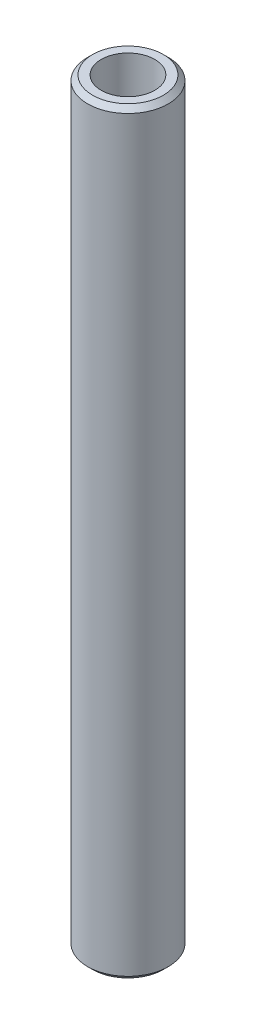
from build123d import *

# Parameters (mm, degrees)
SKETCH1_R           = 12.5
BOSS_EXTRUDE1_DEPTH = 234.681950535
SKETCH2_R           = 8.308721888
CUT_EXTRUDE1_DEPTH  = 236.346803478
CHAMFER1_SIZE       = 1.542651044


with BuildPart() as part:
    # Sketch1 → Boss-Extrude1 (new body)
    with BuildSketch(Plane(origin=(0, 0, 0), x_dir=(1, 0, 0), z_dir=(0, 1, 0))):
        Circle(SKETCH1_R)
    extrude(amount=BOSS_EXTRUDE1_DEPTH)

    # Sketch2 → Cut-Extrude1 (cut, through all)
    with BuildSketch(Plane(origin=(0, 0, 0), x_dir=(1, 0, 0), z_dir=(0, 1, 0))):
        Circle(SKETCH2_R)
    extrude(amount=CUT_EXTRUDE1_DEPTH, mode=Mode.SUBTRACT)

    # Chamfer1
    chamfer1_edges = [part.edges().sort_by_distance(p)[0] for p in [
        (-12.5, 234.681950535, 0),
        (-12.5, 0, 0),
    ]]
    chamfer(chamfer1_edges, length=CHAMFER1_SIZE)


solid = part.part
